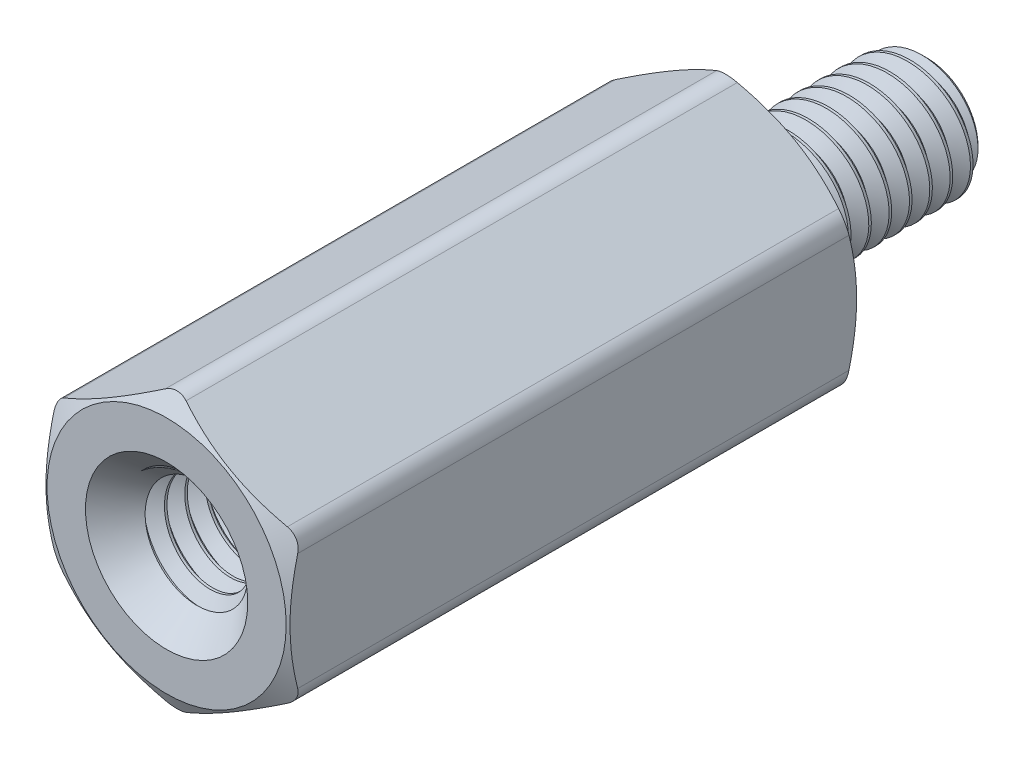
from build123d import *

# Parameters (mm, degrees)
SKETCH4_R           = 2.25
BOSS_EXTRUDE1_DEPTH = 14
SKETCH5_OUTSIDE_W   = 82.324
SKETCH5_OUTSIDE_H   = 83.252
SKETCH5_OUTSIDE_R   = 2.94
CUT_EXTRUDE1_DEPTH  = 20.253311403
CUT_EXTRUDE1_DRAFT  = -60
SKETCH6_OUTSIDE_W   = 66.658
SKETCH6_OUTSIDE_H   = 67.586
SKETCH6_OUTSIDE_R   = 2.94
CUT_EXTRUDE2_DEPTH  = 15.730919863
CUT_EXTRUDE2_DRAFT  = -60
FILLET1_R           = 0.51
CUT_SWEEP1_PITCH    = 0.5
SKETCH9_R           = 1.75
BOSS_EXTRUDE2_DEPTH = 6.4
SKETCH10_W          = 6.4
SKETCH10_H          = 1.5
CUT_SWEEP2_PITCH    = 0.5


with BuildPart() as part:
    # Sketch3 → Revolve1 (revolve)
    with BuildSketch(Plane(origin=(0, 0, 0), x_dir=(0, 0, -1), z_dir=(1, 0, 0))):
        with BuildLine():
            Line((-7.6, 1.25), (-7.6, 0))
            Line((-7.6, 0), (4.7, 0))
            Line((4.7, 0), (4.7, 1.25))
            Line((4.7, 1.25), (4.45, 1.5))
            Line((4.45, 1.5), (0.7515, 1.5))
            Line((0.7515, 1.5), (0.564, 1.175240474))
            Line((0.564, 1.175240474), (0.25, 1.175240474))
            ThreePointArc((0.25, 1.175240474), (0.073223305, 1.248463778), (0, 1.425240474))
            Line((0, 1.425240474), (0, 3))
            Line((0, 3), (-14, 3))
            Line((-14, 3), (-14, 1.75))
            Line((-14, 1.75), (-13.75, 1.5))
            Line((-13.75, 1.5), (-7.85, 1.5))
            Line((-7.85, 1.5), (-7.6, 1.25))
        make_face()
    revolve(axis=Axis((0, 0, -4.7), (0, 0, 1)))

    # Sketch4 → Boss-Extrude1 (add)
    with BuildSketch(Plane.XY.offset(14)):
        Polygon((-3, 1.732050808), (-3, -1.732050808), (0, -3.464101615), (3, -1.732050808), (3, 1.732050808), (0, 3.464101615), align=None)
        Circle(SKETCH4_R, mode=Mode.SUBTRACT)
    extrude(amount=-BOSS_EXTRUDE1_DEPTH)


with BuildPart() as cut_extrude1_tool:
    # Sketch5 outside → Cut-Extrude1 (with draft: the straight prism first)
    with BuildSketch(Plane.XY.offset(14)):
        Rectangle(SKETCH5_OUTSIDE_W, SKETCH5_OUTSIDE_H)
        Circle(SKETCH5_OUTSIDE_R, mode=Mode.SUBTRACT)
    extrude(amount=-CUT_EXTRUDE1_DEPTH)
    # Cut-Extrude1: the draft: its side faces are tilted about the plane it starts from
    cut_extrude1_sides = [cut_extrude1_tool.faces().sort_by_distance(p)[0] for p in [
        (0, -41.626, 3.873344298),
        (41.162, 0, 3.873344298),
        (0, 41.626, 3.873344298),
        (-41.162, 0, 3.873344298),
        (-2.94, 0, 3.873344298),
    ]]
    draft(cut_extrude1_sides, Plane.XY.offset(14), CUT_EXTRUDE1_DRAFT)


with BuildPart() as part_1:
    add(part.part)

    # Cut-Extrude1: cut by cut_extrude1_tool
    add(cut_extrude1_tool.part, mode=Mode.SUBTRACT)


with BuildPart() as cut_extrude2_tool:
    # Sketch6 outside → Cut-Extrude2 (with draft: the straight prism first)
    with BuildSketch(Plane(origin=(0, 0, 0), x_dir=(-1, 0, 0), z_dir=(0, 0, -1))):
        Rectangle(SKETCH6_OUTSIDE_W, SKETCH6_OUTSIDE_H)
        Circle(SKETCH6_OUTSIDE_R, mode=Mode.SUBTRACT)
    extrude(amount=-CUT_EXTRUDE2_DEPTH)
    # Cut-Extrude2: the draft: its side faces are tilted about the plane it starts from
    cut_extrude2_sides = [cut_extrude2_tool.faces().sort_by_distance(p)[0] for p in [
        (0, -33.793, 7.865459931),
        (-33.329, 0, 7.865459931),
        (0, 33.793, 7.865459931),
        (33.329, 0, 7.865459931),
        (2.94, 0, 7.865459931),
    ]]
    draft(cut_extrude2_sides, Plane(origin=(0, 0, 0), x_dir=(-1, 0, 0), z_dir=(0, 0, -1)), CUT_EXTRUDE2_DRAFT)


with BuildPart() as part_2:
    add(part_1.part)

    # Cut-Extrude2: cut by cut_extrude2_tool
    add(cut_extrude2_tool.part, mode=Mode.SUBTRACT)

    # Fillet1
    fillet1_edges = [part_2.edges().sort_by_distance(p)[0] for p in [
        (0, 3.464101615, 7),
        (-3, -1.732050808, 7),
        (0, -3.464101615, 7),
        (3, -1.732050808, 7),
        (3, 1.732050808, 7),
        (-3, 1.732050808, 7),
    ]]
    fillet(fillet1_edges, radius=FILLET1_R)

    # Cut-Sweep1: the profile of Sketch7 profile screwed along a right-hand helix of 9.118 turns, 6 arcs to a turn; built about Z, then put on its axis
    cut_sweep1_z = Axis((0, 0, 0), (0, 0, 1))
    cut_sweep1_corners = [(1.174940474, 0, -0.187673205), (1.174940474, 0, -0.249826795), (1.527063294, 0, -0.453125), (1.527063294, 0, 0.015625)]
    with BuildLine(mode=Mode.PRIVATE) as cut_sweep1_profile:
        Line(cut_sweep1_corners[0], cut_sweep1_corners[1])
        Line(cut_sweep1_corners[1], cut_sweep1_corners[2])
        Line(cut_sweep1_corners[2], cut_sweep1_corners[3])
        Line(cut_sweep1_corners[3], cut_sweep1_corners[0])
    cut_sweep1_cap = Face(cut_sweep1_profile.wire())
    cut_sweep1_turn_angles = [0, 30, 60, 90, 120, 150, 180, 210, 240, 270, 300, 330, 360]
    cut_sweep1_turn_weights = [1, 0.8660254037844387, 1, 0.8660254037844387, 1, 0.8660254037844387, 1, 0.8660254037844387, 1, 0.8660254037844387, 1, 0.8660254037844387, 1]
    cut_sweep1_turn_rails = [Edge.make_bspline([Vector(p[0], p[1], 0).rotate(cut_sweep1_z, cut_sweep1_turn_angles[k]) / cut_sweep1_turn_weights[k] + Vector(0, 0, p[2] + CUT_SWEEP1_PITCH * cut_sweep1_turn_angles[k] / 360) for k in range(13)], [0, 0, 0, 1, 1, 2, 2, 3, 3, 4, 4, 5, 5, 6, 6, 6], 2, cut_sweep1_turn_weights) for p in cut_sweep1_corners]
    cut_sweep1_turn_sides = [Face.make_surface_from_curves(cut_sweep1_turn_rails[p[0]], cut_sweep1_turn_rails[p[1]]) for p in [(0, 1), (1, 2), (2, 3), (3, 0)]]
    cut_sweep1_last_angles = [3240, 3261.24, 3282.48]
    cut_sweep1_last_weights = [1, 0.9320711124581951, 1]
    cut_sweep1_last_rails = [Edge.make_bspline([Vector(p[0], p[1], 0).rotate(cut_sweep1_z, cut_sweep1_last_angles[k]) / cut_sweep1_last_weights[k] + Vector(0, 0, p[2] + CUT_SWEEP1_PITCH * cut_sweep1_last_angles[k] / 360) for k in range(3)], [0, 0, 0, 1, 1, 1], 2, cut_sweep1_last_weights) for p in cut_sweep1_corners]
    cut_sweep1_last_sides = [Face.make_surface_from_curves(cut_sweep1_last_rails[p[0]], cut_sweep1_last_rails[p[1]]) for p in [(0, 1), (1, 2), (2, 3), (3, 0)]]
    cut_sweep1 = Plane(origin=(0, 0, -4.7), x_dir=(0, 1, 0), z_dir=(0, 0, 1)) * Solid(Shell([*[p.moved(Location((0, 0, CUT_SWEEP1_PITCH * i))) for i in range(9) for p in cut_sweep1_turn_sides], *cut_sweep1_last_sides, cut_sweep1_cap, cut_sweep1_cap.rotate(cut_sweep1_z, 3282.48).moved(Location((0, 0, CUT_SWEEP1_PITCH * 3282.48 / 360)))]))
    add(cut_sweep1, mode=Mode.SUBTRACT)

    # Sketch9 → Boss-Extrude2 (add)
    with BuildSketch(Plane.XY.offset(7.6)):
        Circle(SKETCH9_R)
    extrude(amount=BOSS_EXTRUDE2_DEPTH)


with BuildPart() as body_2:
    # Sketch10 → Revolve2 (revolve)
    with BuildSketch(Plane(origin=(0, 0, 0), x_dir=(0, 0, -1), z_dir=(1, 0, 0))):
        with Locations((-10.8, 0.75)):
            Rectangle(SKETCH10_W, SKETCH10_H)
    revolve(axis=Axis((0, 0, -4.7), (0, 0, 1)))

    # Cut-Sweep2: the profile of Sketch12 profile screwed along a right-hand helix of 13.8 turns, 6 arcs to a turn; built about Z, then put on its axis
    cut_sweep2_z = Axis((0, 0, 0), (0, 0, 1))
    cut_sweep2_corners = [(1.174940474, 0, -0.249826795), (1.174940474, 0, -0.187673205), (1.527063294, 0, 0.015625), (1.527063294, 0, -0.453125)]
    with BuildLine(mode=Mode.PRIVATE) as cut_sweep2_profile:
        Line(cut_sweep2_corners[0], cut_sweep2_corners[1])
        Line(cut_sweep2_corners[1], cut_sweep2_corners[2])
        Line(cut_sweep2_corners[2], cut_sweep2_corners[3])
        Line(cut_sweep2_corners[3], cut_sweep2_corners[0])
    cut_sweep2_cap = Face(cut_sweep2_profile.wire())
    cut_sweep2_turn_angles = [0, 30, 60, 90, 120, 150, 180, 210, 240, 270, 300, 330, 360]
    cut_sweep2_turn_weights = [1, 0.8660254037844387, 1, 0.8660254037844387, 1, 0.8660254037844387, 1, 0.8660254037844387, 1, 0.8660254037844387, 1, 0.8660254037844387, 1]
    cut_sweep2_turn_rails = [Edge.make_bspline([Vector(p[0], p[1], 0).rotate(cut_sweep2_z, cut_sweep2_turn_angles[k]) / cut_sweep2_turn_weights[k] + Vector(0, 0, p[2] + CUT_SWEEP2_PITCH * cut_sweep2_turn_angles[k] / 360) for k in range(13)], [0, 0, 0, 1, 1, 2, 2, 3, 3, 4, 4, 5, 5, 6, 6, 6], 2, cut_sweep2_turn_weights) for p in cut_sweep2_corners]
    cut_sweep2_turn_sides = [Face.make_surface_from_curves(cut_sweep2_turn_rails[p[0]], cut_sweep2_turn_rails[p[1]]) for p in [(0, 1), (1, 2), (2, 3), (3, 0)]]
    cut_sweep2_last_angles = [4680, 4710, 4740, 4770, 4800, 4830, 4860, 4890, 4920, 4944, 4968]
    cut_sweep2_last_weights = [1, 0.8660254037844387, 1, 0.8660254037844387, 1, 0.8660254037844387, 1, 0.8660254037844387, 1, 0.9135454576426139, 1]
    cut_sweep2_last_rails = [Edge.make_bspline([Vector(p[0], p[1], 0).rotate(cut_sweep2_z, cut_sweep2_last_angles[k]) / cut_sweep2_last_weights[k] + Vector(0, 0, p[2] + CUT_SWEEP2_PITCH * cut_sweep2_last_angles[k] / 360) for k in range(11)], [0, 0, 0, 1, 1, 2, 2, 3, 3, 4, 4, 5, 5, 5], 2, cut_sweep2_last_weights) for p in cut_sweep2_corners]
    cut_sweep2_last_sides = [Face.make_surface_from_curves(cut_sweep2_last_rails[p[0]], cut_sweep2_last_rails[p[1]]) for p in [(0, 1), (1, 2), (2, 3), (3, 0)]]
    cut_sweep2 = Plane(origin=(0, 0, 14), x_dir=(0, 1, 0), z_dir=(0, 0, -1)) * Solid(Shell([*[p.moved(Location((0, 0, CUT_SWEEP2_PITCH * i))) for i in range(13) for p in cut_sweep2_turn_sides], *cut_sweep2_last_sides, cut_sweep2_cap, cut_sweep2_cap.rotate(cut_sweep2_z, 4968).moved(Location((0, 0, CUT_SWEEP2_PITCH * 4968 / 360)))]))
    add(cut_sweep2, mode=Mode.SUBTRACT)


with BuildPart() as part_3:
    add(part_2.part)

    # Combine1: cut body 2
    add(body_2.part, mode=Mode.SUBTRACT)

    # Cut-Extrude3 cone 1 section (through the dimple's axis) → Cut-Extrude3 (revolve, cut)
    with BuildSketch(Plane(origin=(0, 0, 14), x_dir=(0, -1, 0), z_dir=(1, 0, 0))):
        Polygon((0, 0), (1.995, 0), (0, 1.995), align=None)
    revolve(axis=Axis((0, 0, 14), (0, 0, -1)), mode=Mode.SUBTRACT)


solid = part_3.part
